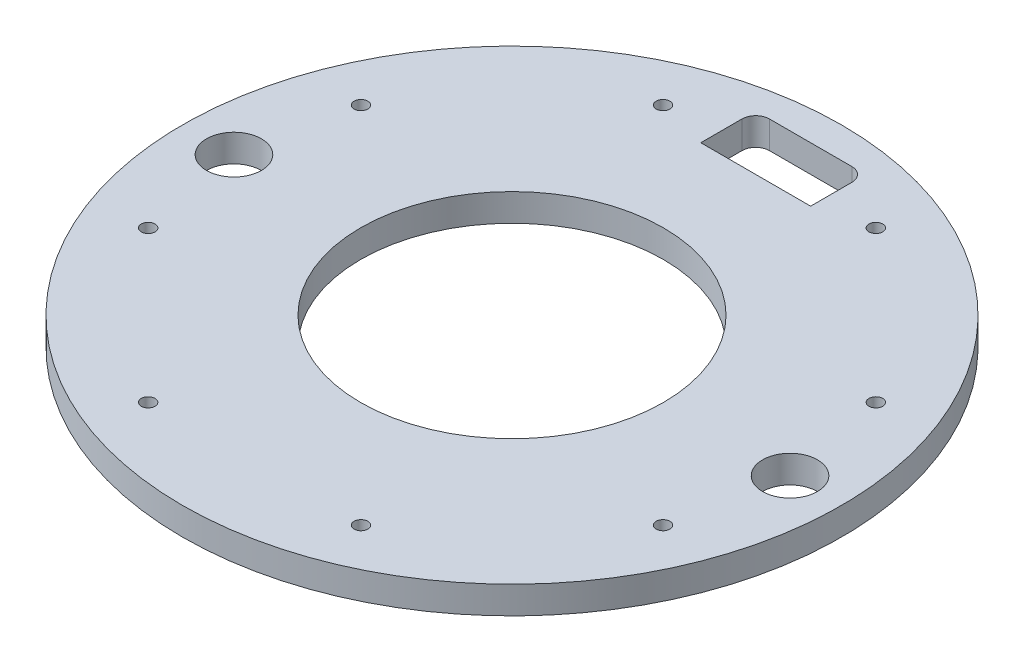
from build123d import *

# Parameters (mm, degrees)
SKETCH1_R           = 76.2
BOSS_EXTRUDE1_DEPTH = 6.35
SKETCH2_R           = 35
CUT_EXTRUDE1_DEPTH  = 6.35
SKETCH3_R           = 6.35
CUT_EXTRUDE2_DEPTH  = 10
SKETCH6_W           = 25.4
SKETCH6_H           = 12.7
CUT_EXTRUDE3_DEPTH  = 10
FILLET1_R           = 3.175
SKETCH7_R           = 1.5875
CUT_EXTRUDE4_DEPTH  = 10


with BuildPart() as part:
    # Sketch1 → Boss-Extrude1 (new body)
    with BuildSketch(Plane(origin=(0, 0, 0), x_dir=(1, 0, 0), z_dir=(0, 1, 0))):
        Circle(SKETCH1_R)
    extrude(amount=BOSS_EXTRUDE1_DEPTH)

    # Sketch2 → Cut-Extrude1 (cut)
    with BuildSketch(Plane(origin=(0, 6.35, 0), x_dir=(1, 0, 0), z_dir=(0, 1, 0))):
        Circle(SKETCH2_R)
    extrude(amount=-CUT_EXTRUDE1_DEPTH, mode=Mode.SUBTRACT)

    # Sketch3 → Cut-Extrude2 (cut)
    with BuildSketch(Plane(origin=(0, 6.35, 0), x_dir=(1, 0, 0), z_dir=(0, 1, 0))):
        with Locations((-64.2875, 0)):
            Circle(SKETCH3_R)
        with Locations((64.2875, 0)):
            Circle(SKETCH3_R)
    extrude(amount=-CUT_EXTRUDE2_DEPTH, mode=Mode.SUBTRACT)

    # Sketch6 → Cut-Extrude3 (cut)
    with BuildSketch(Plane(origin=(0, 6.35, 0), x_dir=(1, 0, 0), z_dir=(0, 1, 0))):
        with Locations((0, 62.6999)):
            Rectangle(SKETCH6_W, SKETCH6_H)
    extrude(amount=-CUT_EXTRUDE3_DEPTH, mode=Mode.SUBTRACT)

    # Fillet1
    fillet1_edges = [part.edges().sort_by_distance(p)[0] for p in [
        (-12.7, 3.175, -69.0499),
        (12.7, 3.175, -69.0499),
    ]]
    fillet(fillet1_edges, radius=FILLET1_R)

    # Sketch7 → Cut-Extrude4 (cut)
    with BuildSketch(Plane(origin=(0, 6.35, 0), x_dir=(1, 0, 0), z_dir=(0, 1, 0))):
        with Locations((-24.5999, 59.5249)):
            Circle(SKETCH7_R)
        with Locations((24.5999, 59.5249)):
            Circle(SKETCH7_R)
        with Locations((24.5999, -59.5249)):
            Circle(SKETCH7_R)
        with Locations((-24.5999, -59.5249)):
            Circle(SKETCH7_R)
        with Locations((-59.5249, 24.5999)):
            Circle(SKETCH7_R)
        with Locations((-59.5249, -24.5999)):
            Circle(SKETCH7_R)
        with Locations((59.5249, 24.5999)):
            Circle(SKETCH7_R)
        with Locations((59.5249, -24.5999)):
            Circle(SKETCH7_R)
    extrude(amount=-CUT_EXTRUDE4_DEPTH, mode=Mode.SUBTRACT)


solid = part.part
